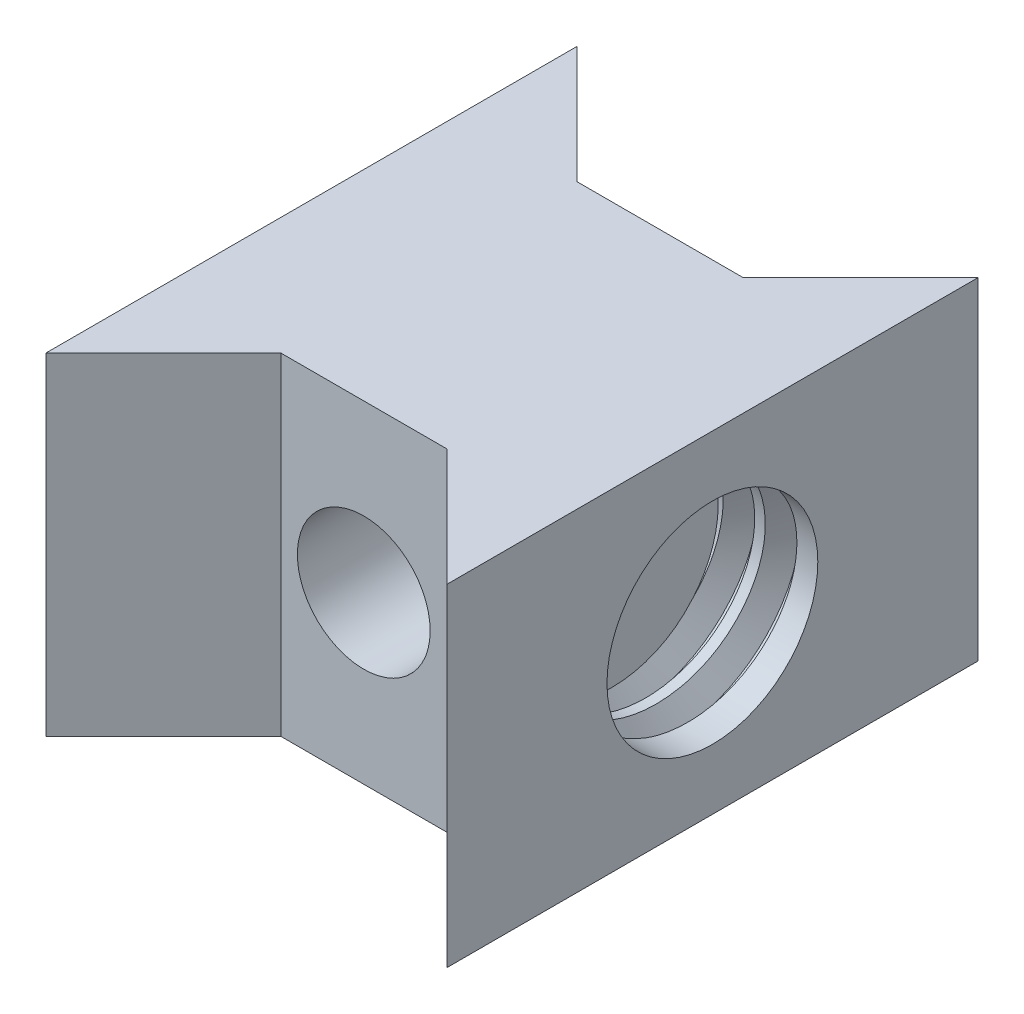
from build123d import *
from build123d.topology import SkipClean

# Parameters (mm, degrees)
BOSS_EXTRUDE1_DEPTH = 10
SKETCH3_R           = 3.175
CUT_EXTRUDE4_DEPTH  = 3
THREAD3_PITCH       = 1.27
THREAD4_PITCH       = 1.27
SKETCH13_R          = 2
CUT_EXTRUDE5_DEPTH  = 21.026821903


with BuildPart() as part:
    # Sketch1 → Boss-Extrude1 (new body)
    with BuildSketch(Plane(origin=(0, 0, 0), x_dir=(1, 0, 0), z_dir=(0, 1, 0))):
        Polygon((0, 0), (0, 8), (-3.535533906, 4.464466094), (-8.535533906, 4.464466094), (-12.071067812, 8), (-12.071067812, -8), (-8.535533906, -4.464466094), (-3.535533906, -4.464466094), (0, -8), align=None)
    extrude(amount=BOSS_EXTRUDE1_DEPTH)

    # Sketch3 → Cut-Extrude4 (cut)
    with BuildSketch(Plane(origin=(0, 0, 0), x_dir=(0, 0, -1), z_dir=(1, 0, 0))):
        with Locations((0, 5)):
            Circle(SKETCH3_R)
    cut_extrude4 = extrude(amount=-CUT_EXTRUDE4_DEPTH, mode=Mode.SUBTRACT)

    # Mirror2: Cut-Extrude4 across plane
    add(cut_extrude4.mirror(Plane(origin=(-6.035533906, 0, 0), x_dir=(0, 0, 1), z_dir=(1, 0, 0))), mode=Mode.SUBTRACT)

    # Thread3: the profile of Thread Profile3 profile screwed along a right-hand helix of 2.362205 turns, 8 arcs to a turn; built about Z, then put on its axis
    with SkipClean():  # the faces are left unmerged after this step: merging them gives an invalid solid
        thread3_z = Axis((0, 0, 0), (0, 0, 1))
        thread3_corners = [(3.1747, 0, -0.000173205), (3.862407661, 0, 0.396874998), (3.862407661, 0, 0.555624998), (3.1747, 0, 0.952673202)]
        with BuildLine(mode=Mode.PRIVATE) as thread3_profile:
            Line(thread3_corners[0], thread3_corners[1])
            Line(thread3_corners[1], thread3_corners[2])
            Line(thread3_corners[2], thread3_corners[3])
            Line(thread3_corners[3], thread3_corners[0])
        thread3_cap = Face(thread3_profile.wire())
        thread3_turn_angles = [0, 22.5, 45, 67.5, 90, 112.5, 135, 157.5, 180, 202.5, 225, 247.5, 270, 292.5, 315, 337.5, 360]
        thread3_turn_weights = [1, 0.9238795325112867, 1, 0.9238795325112867, 1, 0.9238795325112867, 1, 0.9238795325112867, 1, 0.9238795325112867, 1, 0.9238795325112867, 1, 0.9238795325112867, 1, 0.9238795325112867, 1]
        thread3_turn_rails = [Edge.make_bspline([Vector(p[0], p[1], 0).rotate(thread3_z, thread3_turn_angles[k]) / thread3_turn_weights[k] + Vector(0, 0, p[2] + THREAD3_PITCH * thread3_turn_angles[k] / 360) for k in range(17)], [0, 0, 0, 1, 1, 2, 2, 3, 3, 4, 4, 5, 5, 6, 6, 7, 7, 8, 8, 8], 2, thread3_turn_weights) for p in thread3_corners]
        thread3_turn_sides = [Face.make_surface_from_curves(thread3_turn_rails[p[0]], thread3_turn_rails[p[1]]) for p in [(0, 1), (1, 2), (2, 3), (3, 0)]]
        thread3_last_angles = [720, 742.5, 765, 787.5, 810, 830.196850394, 850.393700787]
        thread3_last_weights = [1, 0.9238795325112867, 1, 0.9238795325112867, 1, 0.9385120027288909, 1]
        thread3_last_rails = [Edge.make_bspline([Vector(p[0], p[1], 0).rotate(thread3_z, thread3_last_angles[k]) / thread3_last_weights[k] + Vector(0, 0, p[2] + THREAD3_PITCH * thread3_last_angles[k] / 360) for k in range(7)], [0, 0, 0, 1, 1, 2, 2, 3, 3, 3], 2, thread3_last_weights) for p in thread3_corners]
        thread3_last_sides = [Face.make_surface_from_curves(thread3_last_rails[p[0]], thread3_last_rails[p[1]]) for p in [(0, 1), (1, 2), (2, 3), (3, 0)]]
        thread3 = Plane(origin=(0, 5, 0), x_dir=(0, 0, 1), z_dir=(-1, 0, 0)) * Solid(Shell([*[p.moved(Location((0, 0, THREAD3_PITCH * i))) for i in range(2) for p in thread3_turn_sides], *thread3_last_sides, thread3_cap, thread3_cap.rotate(thread3_z, 850.393700787).moved(Location((0, 0, THREAD3_PITCH * 850.393700787 / 360)))]))
        add(thread3, mode=Mode.SUBTRACT)

    # Thread4: the profile of Thread Profile4 profile screwed along a right-hand helix of 2.362205 turns, 8 arcs to a turn; built about Z, then put on its axis
    with SkipClean():  # the faces are left unmerged after this step: merging them gives an invalid solid
        thread4_z = Axis((0, 0, 0), (0, 0, 1))
        thread4_corners = [(3.1747, 0, -0.000173205), (3.862407661, 0, 0.396874998), (3.862407661, 0, 0.555624998), (3.1747, 0, 0.952673202)]
        with BuildLine(mode=Mode.PRIVATE) as thread4_profile:
            Line(thread4_corners[0], thread4_corners[1])
            Line(thread4_corners[1], thread4_corners[2])
            Line(thread4_corners[2], thread4_corners[3])
            Line(thread4_corners[3], thread4_corners[0])
        thread4_cap = Face(thread4_profile.wire())
        thread4_turn_angles = [0, 22.5, 45, 67.5, 90, 112.5, 135, 157.5, 180, 202.5, 225, 247.5, 270, 292.5, 315, 337.5, 360]
        thread4_turn_weights = [1, 0.9238795325112867, 1, 0.9238795325112867, 1, 0.9238795325112867, 1, 0.9238795325112867, 1, 0.9238795325112867, 1, 0.9238795325112867, 1, 0.9238795325112867, 1, 0.9238795325112867, 1]
        thread4_turn_rails = [Edge.make_bspline([Vector(p[0], p[1], 0).rotate(thread4_z, thread4_turn_angles[k]) / thread4_turn_weights[k] + Vector(0, 0, p[2] + THREAD4_PITCH * thread4_turn_angles[k] / 360) for k in range(17)], [0, 0, 0, 1, 1, 2, 2, 3, 3, 4, 4, 5, 5, 6, 6, 7, 7, 8, 8, 8], 2, thread4_turn_weights) for p in thread4_corners]
        thread4_turn_sides = [Face.make_surface_from_curves(thread4_turn_rails[p[0]], thread4_turn_rails[p[1]]) for p in [(0, 1), (1, 2), (2, 3), (3, 0)]]
        thread4_last_angles = [720, 742.5, 765, 787.5, 810, 830.196850394, 850.393700787]
        thread4_last_weights = [1, 0.9238795325112867, 1, 0.9238795325112867, 1, 0.9385120027288909, 1]
        thread4_last_rails = [Edge.make_bspline([Vector(p[0], p[1], 0).rotate(thread4_z, thread4_last_angles[k]) / thread4_last_weights[k] + Vector(0, 0, p[2] + THREAD4_PITCH * thread4_last_angles[k] / 360) for k in range(7)], [0, 0, 0, 1, 1, 2, 2, 3, 3, 3], 2, thread4_last_weights) for p in thread4_corners]
        thread4_last_sides = [Face.make_surface_from_curves(thread4_last_rails[p[0]], thread4_last_rails[p[1]]) for p in [(0, 1), (1, 2), (2, 3), (3, 0)]]
        thread4 = Plane(origin=(-12.071067812, 5, 0), x_dir=(0, 0, -1), z_dir=(1, 0, 0)) * Solid(Shell([*[p.moved(Location((0, 0, THREAD4_PITCH * i))) for i in range(2) for p in thread4_turn_sides], *thread4_last_sides, thread4_cap, thread4_cap.rotate(thread4_z, 850.393700787).moved(Location((0, 0, THREAD4_PITCH * 850.393700787 / 360)))]))
        add(thread4, mode=Mode.SUBTRACT)

    # Sketch13 → Cut-Extrude5 (cut, through all)
    with SkipClean():  # the faces are left unmerged after this step: merging them gives an invalid solid
        with BuildSketch(Plane.XY.offset(4.464466094)):
            with Locations((-6.035533906, 5)):
                Circle(SKETCH13_R)
        extrude(amount=-CUT_EXTRUDE5_DEPTH, mode=Mode.SUBTRACT)


solid = part.part
